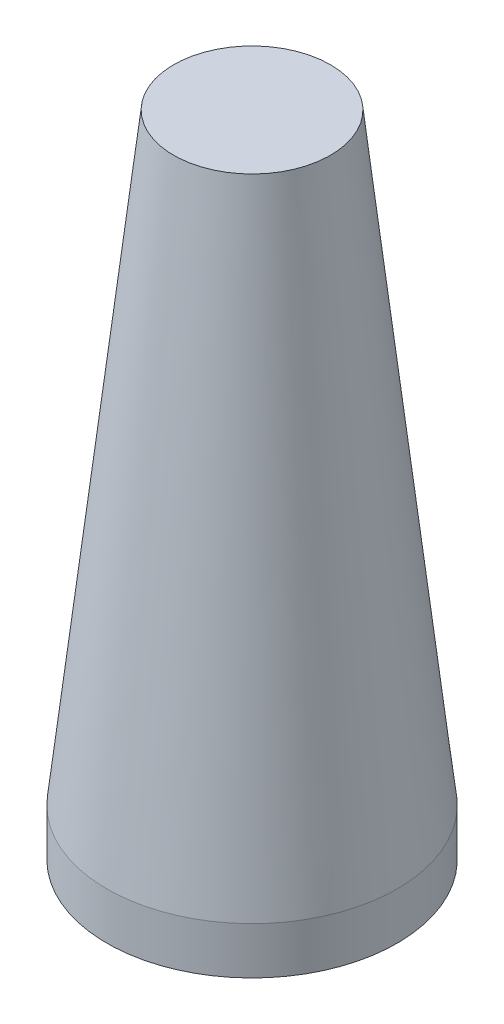
from build123d import *


with BuildPart() as part:
    # Sketch1 → Revolve1 (revolve)
    with BuildSketch(Plane.XY):
        Polygon((-94.064695228, 790), (0, 790), (0, 800), (-100, 800), (-185, 32.501032947), (-185, -27.498967053), (-178, -27.498967053), (-178, 32.501032947), align=None)
    revolve(axis=Axis((0, -27.498967053, 0), (0, 1, 0)))


solid = part.part
